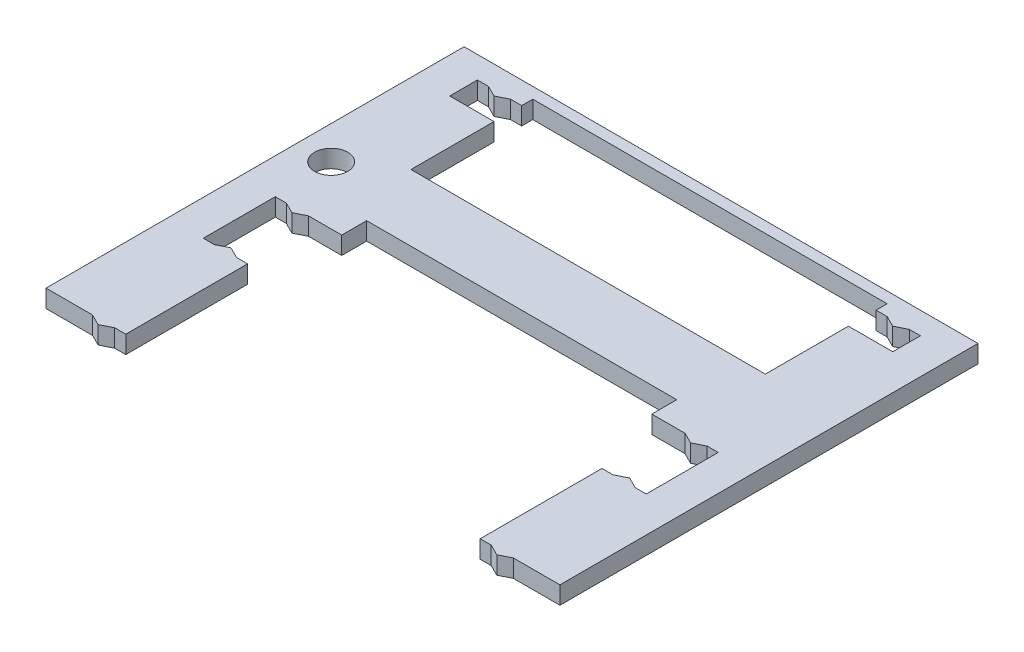
from build123d import *

# Parameters (mm, degrees)
SKETCH1_R           = 1.5
BOSS_EXTRUDE1_DEPTH = 1.6


with BuildPart() as part:
    # Sketch1 → Boss-Extrude1 (new body)
    with BuildSketch(Plane(origin=(0, 0, 0), x_dir=(1, 0, 0), z_dir=(0, 1, 0))):
        Polygon((-65.832583289, 0), (-61.629583289, 0), (-60.629583289, -0.5), (-59.629583289, 0), (-58.629583289, 0), (-58.629583289, 11), (-59.629583289, 11), (-60.629583289, 11.5), (-61.629583289, 11), (-62.629583289, 11), (-62.629583289, 17.5), (-61.629583289, 17.5), (-60.629583289, 17), (-59.629583289, 17.5), (-56.629583289, 17.5), (-56.629583289, 19.75), (-28.629583289, 19.75), (-28.629583289, 17.5), (-25.629583289, 17.5), (-24.629583289, 17), (-23.629583289, 17.5), (-22.629583289, 17.5), (-22.629583289, 11), (-23.629583289, 11), (-24.629583289, 11.5), (-25.629583289, 11), (-26.629583289, 11), (-26.629583289, 0), (-25.629583289, 0), (-24.629583289, -0.5), (-23.629583289, 0), (-19.426583289, 0), (-19.426583289, 37.75), (-65.832583289, 37.75), align=None)
        with Locations((-62.832583289, 22.75)):
            Circle(SKETCH1_R, mode=Mode.SUBTRACT)
        Polygon((-26.629583289, 25.75), (-58.629583289, 25.75), (-58.629583289, 33.25), (-62.629583289, 33.25), (-62.629583289, 35.75), (-61.629583289, 35.75), (-60.629583289, 35.25), (-59.629583289, 35.75), (-58.629583289, 35.75), (-58.629583289, 36.75), (-26.629583289, 36.75), (-26.629583289, 35.75), (-25.629583289, 35.75), (-24.629583289, 35.25), (-23.629583289, 35.75), (-22.629583289, 35.75), (-22.629583289, 33.25), (-26.629583289, 33.25), align=None, mode=Mode.SUBTRACT)
    extrude(amount=BOSS_EXTRUDE1_DEPTH)


solid = part.part
